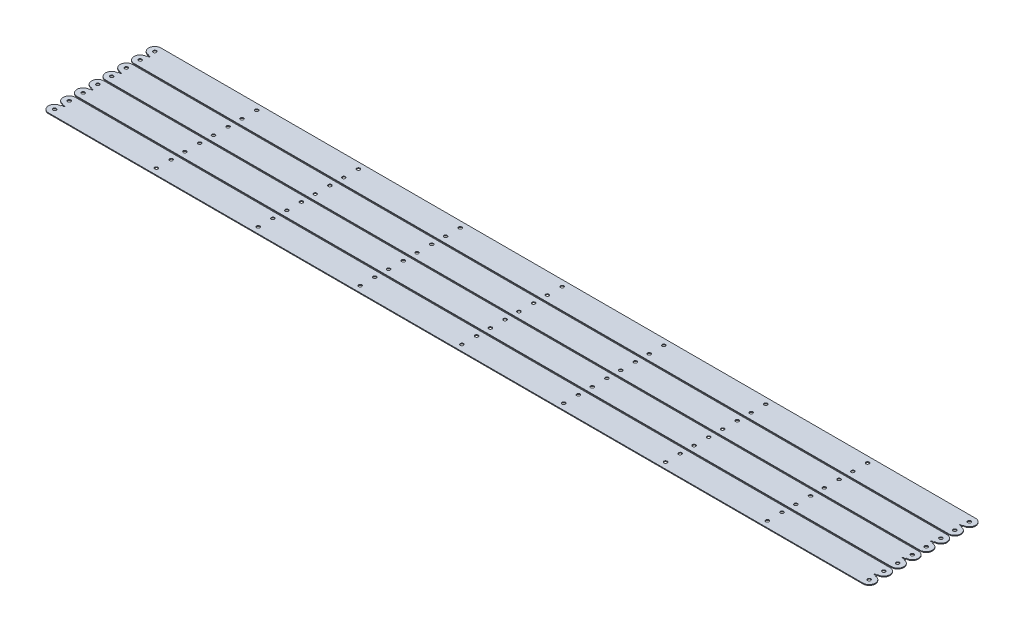
from build123d import *

# Parameters (mm, degrees)
SKETCH1_R           = 2
BOSS_EXTRUDE1_DEPTH = 1
LPATTERN2_COUNT     = 4
LPATTERN2_PITCH     = 35


with BuildPart() as part:
    # Sketch1 → Boss-Extrude1 (new body)
    with BuildSketch(Plane(origin=(0, 0, 0), x_dir=(1, 0, 0), z_dir=(0, 1, 0))):
        with BuildLine():
            ThreePointArc((-507.433034374, -1), (-504.937104415, -5.645794895), (-500, -7.5))
            Line((-500, -7.5), (500, -7.5))
            ThreePointArc((500, -7.5), (507.5, 0), (500, 7.5))
            Line((500, 7.5), (500, 8.5))
            Line((500, 8.5), (497, 8.5))
            Line((497, 8.5), (497, 9.5))
            Line((497, 9.5), (500, 9.5))
            Line((500, 9.5), (500, 10.5))
            ThreePointArc((500, 10.5), (507.5, 18), (500, 25.5))
            Line((500, 25.5), (-500, 25.5))
            ThreePointArc((-500, 25.5), (-507.5, 18), (-500, 10.5))
            Line((-500, 10.5), (-500, 9.5))
            Line((-500, 9.5), (-497, 9.5))
            Line((-497, 9.5), (-497, 8.5))
            Line((-497, 8.5), (-500, 8.5))
            Line((-500, 8.5), (-500, 7.5))
            ThreePointArc((-500, 7.5), (-504.937104415, 5.645794895), (-507.433034374, 1))
            Line((-507.433034374, 1), (-507.5, 1))
            Line((-507.5, 1), (-507.5, -1))
            Line((-507.5, -1), (-507.433034374, -1))
        make_face()
        with Locations((-500, 0)):
            Circle(SKETCH1_R, mode=Mode.SUBTRACT)
        with Locations((-375, 0)):
            Circle(SKETCH1_R, mode=Mode.SUBTRACT)
        with Locations((-250, 0)):
            Circle(SKETCH1_R, mode=Mode.SUBTRACT)
        with Locations((-125, 0)):
            Circle(SKETCH1_R, mode=Mode.SUBTRACT)
        Circle(SKETCH1_R, mode=Mode.SUBTRACT)
        with Locations((125, 0)):
            Circle(SKETCH1_R, mode=Mode.SUBTRACT)
        with Locations((250, 0)):
            Circle(SKETCH1_R, mode=Mode.SUBTRACT)
        with Locations((375, 0)):
            Circle(SKETCH1_R, mode=Mode.SUBTRACT)
        with Locations((500, 0)):
            Circle(SKETCH1_R, mode=Mode.SUBTRACT)
        with Locations((-500, 18)):
            Circle(SKETCH1_R, mode=Mode.SUBTRACT)
        with Locations((-375, 18)):
            Circle(SKETCH1_R, mode=Mode.SUBTRACT)
        with Locations((-250, 18)):
            Circle(SKETCH1_R, mode=Mode.SUBTRACT)
        with Locations((-125, 18)):
            Circle(SKETCH1_R, mode=Mode.SUBTRACT)
        with Locations((0, 18)):
            Circle(SKETCH1_R, mode=Mode.SUBTRACT)
        with Locations((125, 18)):
            Circle(SKETCH1_R, mode=Mode.SUBTRACT)
        with Locations((250, 18)):
            Circle(SKETCH1_R, mode=Mode.SUBTRACT)
        with Locations((375, 18)):
            Circle(SKETCH1_R, mode=Mode.SUBTRACT)
        with Locations((500, 18)):
            Circle(SKETCH1_R, mode=Mode.SUBTRACT)
    extrude(amount=BOSS_EXTRUDE1_DEPTH)


with BuildPart() as lpattern2_1:
    # LPattern2: pattern copy
    add(part.part.moved(Location(Vector(0, 0, -1) * (1 * LPATTERN2_PITCH))))


with BuildPart() as lpattern2_2:
    # LPattern2: pattern copy
    add(part.part.moved(Location(Vector(0, 0, -1) * (2 * LPATTERN2_PITCH))))


with BuildPart() as lpattern2_3:
    # LPattern2: pattern copy
    add(part.part.moved(Location(Vector(0, 0, -1) * (3 * LPATTERN2_PITCH))))


solid = Compound([part.part, lpattern2_1.part, lpattern2_2.part, lpattern2_3.part])
